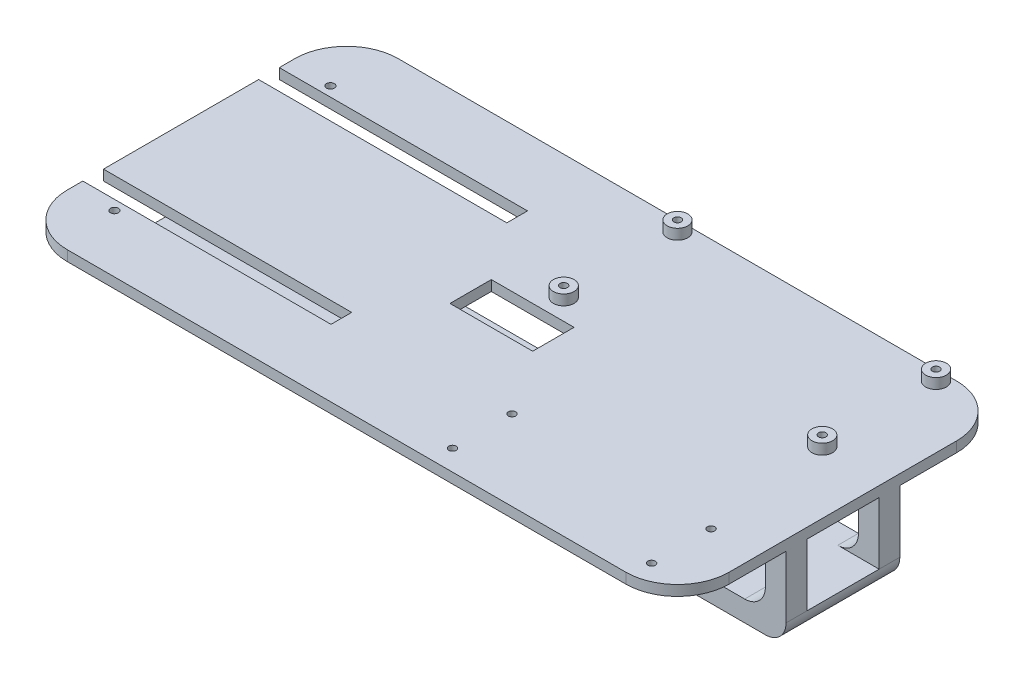
from build123d import *

# Parameters (mm, degrees)
SKETCH1_W                      = 203.2
SKETCH1_H                      = 34.925
BOSS_EXTRUDE1_DEPTH            = 6.35
BOSS_EXTRUDE3_START            = 19.05
SKETCH2_W                      = 203.2
SKETCH2_H                      = 101.6
BOSS_EXTRUDE3_DEPTH            = 3.175
BOSS_EXTRUDE4_REACH            = 117.746
SKETCH3_W                      = 6.35
SKETCH3_H                      = 6.35
SKETCH4_W                      = 76.2
SKETCH4_H                      = 6.35
CUT_EXTRUDE1_DEPTH             = 3.175
BOSS_EXTRUDE5_START            = -190.5
SKETCH5_W                      = 3.175
SKETCH5_H                      = 3.175
BOSS_EXTRUDE5_DEPTH            = 3.175
F_2_CLEARANCE_HOLE1_D          = 2.4384
FILLET1_R                      = 15.875
FILLET2_R                      = 6.35
F_4_40_TAPPED_HOLE2_D          = 2.2606
SKETCH15_R                     = 3.175
BOSS_EXTRUDE6_DEPTH            = 1.5875
SKETCH20_W                     = 1.63195
SKETCH20_H                     = 25.4
F_4_CLEARANCE_HOLE3_AT_2_COUNT = 2
F_4_CLEARANCE_HOLE3_AT_2_PITCH = 18.25625
F_4_CLEARANCE_HOLE3_AT_3_COUNT = 2
F_4_CLEARANCE_HOLE3_AT_3_PITCH = 63.787085414
F_4_CLEARANCE_HOLE3_AT_4_COUNT = 2
F_4_CLEARANCE_HOLE3_AT_4_PITCH = 61.11875
BOSS_EXTRUDE11_DEPTH           = 4.318
FILLET10_RADIUS                = 1.5875
FILLET10_LENGTH                = 4.318
FILLET11_RADIUS                = 1.5875
FILLET11_LENGTH                = 4.318
FILLET12_R                     = 3.175
FILLET14_R                     = 15.875
SKETCH23_R                     = 3.175
BOSS_EXTRUDE12_DEPTH           = 3.175
CUT_EXTRUDE2_REACH             = 121.852
SKETCH26_W                     = 25.4
SKETCH26_H                     = 12.7
F_4_40_TAPPED_HOLE3_D          = 2.2606
F_4_40_TAPPED_HOLE3_DEPTH      = 6.35


with BuildPart() as part:
    # Sketch1 → Boss-Extrude1 (new body)
    with BuildSketch(Plane(origin=(0, 0, 0), x_dir=(1, 0, 0), z_dir=(0, 1, 0))):
        Rectangle(SKETCH1_W, SKETCH1_H)
    extrude(amount=BOSS_EXTRUDE1_DEPTH)


with BuildPart() as body_2:
    # Sketch2 → Boss-Extrude3 (new body)
    with BuildSketch(Plane(origin=(0, 6.35, 0), x_dir=(1, 0, 0), z_dir=(0, 1, 0)).offset(BOSS_EXTRUDE3_START)):
        Rectangle(SKETCH2_W, SKETCH2_H)
    extrude(amount=BOSS_EXTRUDE3_DEPTH)

    # Sketch3 → Boss-Extrude4 (add, up to next)
    with BuildSketch(Plane(origin=(0, 6.35, 0), x_dir=(1, 0, 0), z_dir=(0, 1, 0)), mode=Mode.PRIVATE) as boss_extrude4_sk1:
        with Locations((98.425, -14.2875)):
            Rectangle(SKETCH3_W, SKETCH3_H)
    boss_extrude4_tool1 = extrude(boss_extrude4_sk1.sketch, amount=BOSS_EXTRUDE4_REACH, mode=Mode.PRIVATE) - body_2.part
    # Sketch3 → Boss-Extrude4 (add, up to next)
    with BuildSketch(Plane(origin=(0, 6.35, 0), x_dir=(1, 0, 0), z_dir=(0, 1, 0)), mode=Mode.PRIVATE) as boss_extrude4_sk2:
        with Locations((98.425, 14.2875)):
            Rectangle(SKETCH3_W, SKETCH3_H)
    boss_extrude4_tool2 = extrude(boss_extrude4_sk2.sketch, amount=BOSS_EXTRUDE4_REACH, mode=Mode.PRIVATE) - body_2.part

    add(part.part)  # Boss-Extrude4 merges part
    add(boss_extrude4_tool1.solids().sort_by_distance((98.425, 6.35, 14.2875))[0])
    add(boss_extrude4_tool2.solids().sort_by_distance((98.425, 6.35, -14.2875))[0])

    # Sketch4 → Cut-Extrude1 (cut)
    with BuildSketch(Plane(origin=(0, 28.575, 0), x_dir=(1, 0, 0), z_dir=(0, 1, 0))):
        with Locations((-63.5, -26.9875)):
            Rectangle(SKETCH4_W, SKETCH4_H)
        with Locations((-63.5, 26.9875)):
            Rectangle(SKETCH4_W, SKETCH4_H)
    extrude(amount=-CUT_EXTRUDE1_DEPTH, mode=Mode.SUBTRACT)

    # Sketch5 → Boss-Extrude5 (add)
    with BuildSketch(Plane(origin=(101.6, 0, 0), x_dir=(0, 0, -1), z_dir=(1, 0, 0)).offset(BOSS_EXTRUDE5_START)):
        with Locations((-44.45, 23.8125)):
            Rectangle(SKETCH5_W, SKETCH5_H)
        with Locations((44.45, 23.8125)):
            Rectangle(SKETCH5_W, SKETCH5_H)
    extrude(amount=-BOSS_EXTRUDE5_DEPTH)

    # #2 Clearance Hole1 (through all)
    with Locations(Plane(origin=(0, 25.4, 0), x_dir=(-1, 0, 0), z_dir=(0, -1, 0))):
        with Locations((88.9, 33.147), (88.9, -33.147)):
            Hole(F_2_CLEARANCE_HOLE1_D / 2)

    # Fillet1
    fillet1_edges = [body_2.edges().sort_by_distance(p)[0] for p in [
        (101.6, 26.9875, 50.8),
        (101.6, 26.9875, -50.8),
    ]]
    fillet(fillet1_edges, radius=FILLET1_R)

    # Fillet2
    fillet2_edges = [body_2.edges().sort_by_distance(p)[0] for p in [
        (95.25, 6.35, 14.2875),
        (95.25, 6.35, -14.2875),
        (101.6, 0, 0),
    ]]
    fillet(fillet2_edges, radius=FILLET2_R - 0.0001)  # a hair under: the kernel refuses the full size

    # #4-40 Tapped Hole2 (through all)
    with Locations(Plane(origin=(0, 25.4, 0), x_dir=(-1, 0, 0), z_dir=(0, -1, 0))):
        with Locations((-87.3125, -44.45), (-87.3125, -26.19375), (-26.19375, -26.19375), (-26.19375, -44.45)):
            Hole(F_4_40_TAPPED_HOLE2_D / 2)

    # Sketch15 → Boss-Extrude6 (add)
    with BuildSketch(Plane.XZ.offset(-25.4)):
        with Locations(Location((26.19375, 44.45, 0), (0, 0, 270))):
            Circle(SKETCH15_R)
        with Locations(Location((87.3125, 44.45, 0), (0, 0, 270))):
            Circle(SKETCH15_R)
        with Locations(Location((87.3125, 26.19375, 0), (0, 0, 270))):
            Circle(SKETCH15_R)
        with Locations(Location((26.19375, 26.19375, 0), (0, 0, 270))):
            Circle(SKETCH15_R)
    extrude(amount=BOSS_EXTRUDE6_DEPTH)

    # Sketch20 → #4 Clearance Hole3 (revolve, cut)
    with BuildSketch(Plane(origin=(87.3125, 25.4, 44.45), x_dir=(0, 0, 1), z_dir=(1, 0, 0))):
        with Locations((0.815975, 12.7)):
            Rectangle(SKETCH20_W, SKETCH20_H)
    f_4_clearance_hole3 = revolve(axis=Axis((87.3125, 31.75, 44.45), (0, -1, 0)), mode=Mode.SUBTRACT)

    # #4 Clearance Hole3 at 2: #4 Clearance Hole3 ×2
    with Locations(*[(0, 0, -i * F_4_CLEARANCE_HOLE3_AT_2_PITCH) for i in range(1, F_4_CLEARANCE_HOLE3_AT_2_COUNT)]):
        add(f_4_clearance_hole3, mode=Mode.SUBTRACT)

    # #4 Clearance Hole3 at 3: #4 Clearance Hole3 ×2
    with Locations(*[Vector(-0.9581680931685116, 0, -0.28620605380358144) * (i * F_4_CLEARANCE_HOLE3_AT_3_PITCH) for i in range(1, F_4_CLEARANCE_HOLE3_AT_3_COUNT)]):
        add(f_4_clearance_hole3, mode=Mode.SUBTRACT)

    # #4 Clearance Hole3 at 4: #4 Clearance Hole3 ×2
    with Locations(*[(-i * F_4_CLEARANCE_HOLE3_AT_4_PITCH, 0, 0) for i in range(1, F_4_CLEARANCE_HOLE3_AT_4_COUNT)]):
        add(f_4_clearance_hole3, mode=Mode.SUBTRACT)

    # Sketch22 → Boss-Extrude11 (add)
    with BuildSketch(Plane.ZY.offset(101.6)):
        Polygon((17.065625, 0), (12.747625, 0), (12.747625, -6.477), (7.985125, -6.477), (7.985125, -9.652), (17.065625, -9.652), align=None)
        Polygon((-7.985125, -6.477), (-12.747625, -6.477), (-12.747625, 0), (-17.065625, 0), (-17.065625, -9.652), (-7.985125, -9.652), align=None)
    extrude(amount=-BOSS_EXTRUDE11_DEPTH)

    # Fillet10: full round fillet: the end face becomes a half cylinder, R = half its width
    fillet10_face = Plane((-99.441, -8.0645, 7.985125), x_dir=(-1, 0, 0), z_dir=(0, 0, -1))  # on the end face: x along it, z out of the body
    fillet10_slab = fillet10_face.offset(-FILLET10_RADIUS / 2) * Box(FILLET10_LENGTH, 2 * FILLET10_RADIUS, FILLET10_RADIUS, mode=Mode.PRIVATE)  # the body's end, R deep
    fillet10_round = Plane((-99.441, -8.0645, 9.572625), x_dir=(0, 0, -1), z_dir=(-1, 0, 0)) * Cylinder(FILLET10_RADIUS, FILLET10_LENGTH, mode=Mode.PRIVATE)  # its axis R under the face
    add(fillet10_slab - fillet10_round, mode=Mode.SUBTRACT)

    # Fillet11: full round fillet: the end face becomes a half cylinder, R = half its width
    fillet11_face = Plane((-99.441, -8.0645, -7.985125), x_dir=(-1, 0, 0), z_dir=(0, 0, 1))  # on the end face: x along it, z out of the body
    fillet11_slab = fillet11_face.offset(-FILLET11_RADIUS / 2) * Box(FILLET11_LENGTH, 2 * FILLET11_RADIUS, FILLET11_RADIUS, mode=Mode.PRIVATE)  # the body's end, R deep
    fillet11_round = Plane((-99.441, -8.0645, -9.572625), x_dir=(0, 0, 1), z_dir=(-1, 0, 0)) * Cylinder(FILLET11_RADIUS, FILLET11_LENGTH, mode=Mode.PRIVATE)  # its axis R under the face
    add(fillet11_slab - fillet11_round, mode=Mode.SUBTRACT)

    # Fillet12
    fillet12_edges = [body_2.edges().sort_by_distance(p)[0] for p in [
        (-99.441, -9.652, 17.065625),
        (-99.441, -9.652, -17.065625),
    ]]
    fillet(fillet12_edges, radius=FILLET12_R)

    # Fillet14
    fillet14_edges = [body_2.edges().sort_by_distance(p)[0] for p in [
        (-101.6, 26.9875, -50.8),
        (-101.6, 26.9875, 50.8),
    ]]
    fillet(fillet14_edges, radius=FILLET14_R)

    # Sketch23 → Boss-Extrude12 (add)
    with BuildSketch(Plane(origin=(0, 28.575, 0), x_dir=(1, 0, 0), z_dir=(0, 1, 0))):
        with Locations(Location((3.175, 12.7, 0), (0, 0, 90))):
            Circle(SKETCH23_R)
        with Locations(Location((3.175, 47.625, 0), (0, 0, 90))):
            Circle(SKETCH23_R)
        with Locations(Location((82.55, 12.7, 0), (0, 0, 90))):
            Circle(SKETCH23_R)
        with Locations(Location((82.55, 47.625, 0), (0, 0, 90))):
            Circle(SKETCH23_R)
    extrude(amount=BOSS_EXTRUDE12_DEPTH)

    # Sketch26 → Cut-Extrude2 (cut, up to next)
    with BuildSketch(Plane(origin=(0, 28.575, 0), x_dir=(1, 0, 0), z_dir=(0, 1, 0)), mode=Mode.PRIVATE) as cut_extrude2_sk1:
        Rectangle(SKETCH26_W, SKETCH26_H)
    cut_extrude2_tool1 = extrude(cut_extrude2_sk1.sketch, amount=-CUT_EXTRUDE2_REACH, mode=Mode.PRIVATE) & body_2.part
    add(cut_extrude2_tool1.solids().sort_by_distance((0, 28.575, 0))[0], mode=Mode.SUBTRACT)

    # #4-40 Tapped Hole3
    with Locations(Plane(origin=(0, 31.75, 0), x_dir=(1, 0, 0), z_dir=(0, 1, 0))):
        with Locations((3.175, 47.625), (3.175, 12.7), (82.55, 12.7), (82.55, 47.625)):
            Hole(F_4_40_TAPPED_HOLE3_D / 2, depth=F_4_40_TAPPED_HOLE3_DEPTH)


solid = body_2.part
